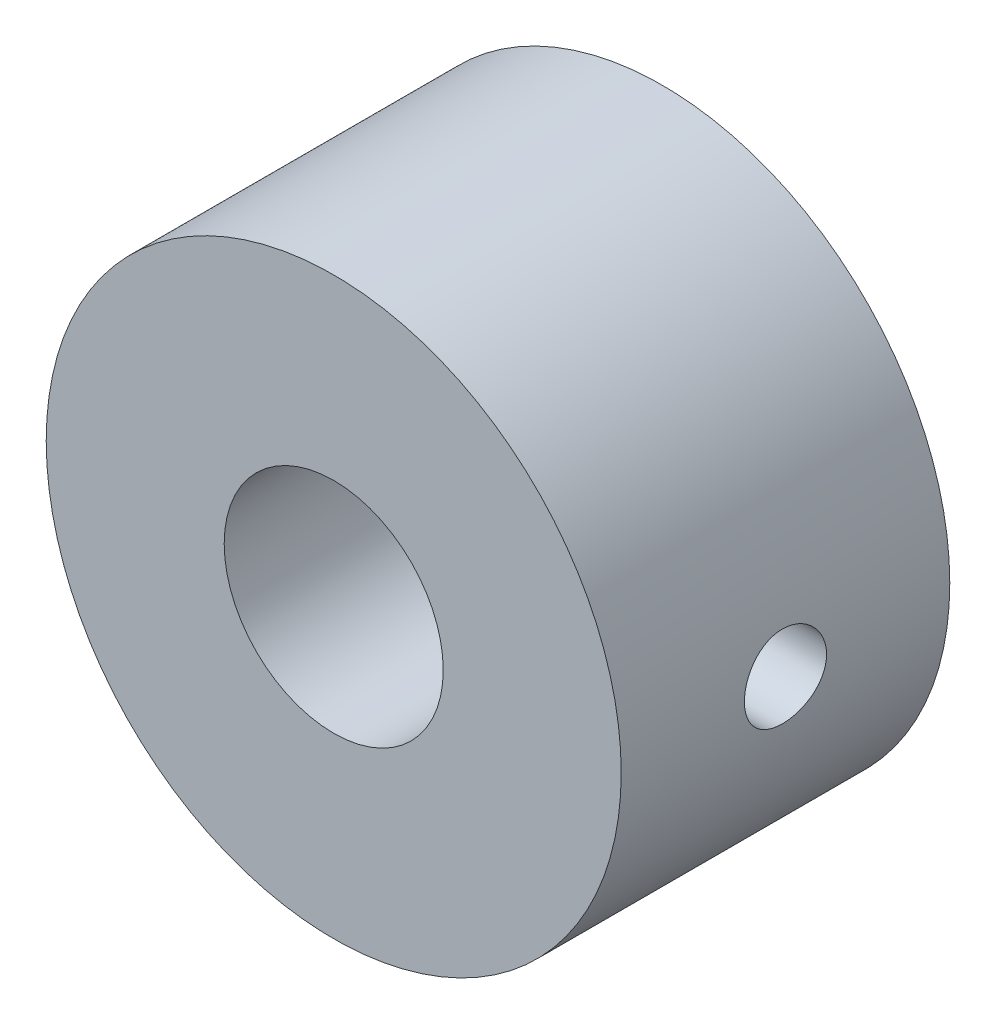
from build123d import *

# Parameters (mm, degrees)
SKETCH1_R               = 10.5
BOSS_EXTRUDE1_DEPTH     = 12
SKETCH2_R               = 4
CUT_EXTRUDE1_DEPTH      = 15
CUT_EXTRUDE2_DEPTH      = 20.091883092
CUT_EXTRUDE2_DEPTH_BACK = 20.091883092
SKETCH3_R               = 1.5


with BuildPart() as part:
    # Sketch1 → Boss-Extrude1 (new body)
    with BuildSketch(Plane.XY):
        Circle(SKETCH1_R)
    extrude(amount=BOSS_EXTRUDE1_DEPTH)

    # Sketch2 → Cut-Extrude1 (cut)
    with BuildSketch(Plane.XY.offset(12)):
        Circle(SKETCH2_R)
    extrude(amount=-CUT_EXTRUDE1_DEPTH, mode=Mode.SUBTRACT)

    # Sketch3 → Cut-Extrude2 (cut, two sides: drawn at the far end of the back side and taken through both)
    with BuildSketch(Plane(origin=(0, 0, 0), x_dir=(0, 0, -1), z_dir=(1, 0, 0)).offset(-CUT_EXTRUDE2_DEPTH_BACK)):
        with Locations((-6, 0)):
            Circle(SKETCH3_R)
    extrude(amount=CUT_EXTRUDE2_DEPTH + CUT_EXTRUDE2_DEPTH_BACK, mode=Mode.SUBTRACT)


solid = part.part
